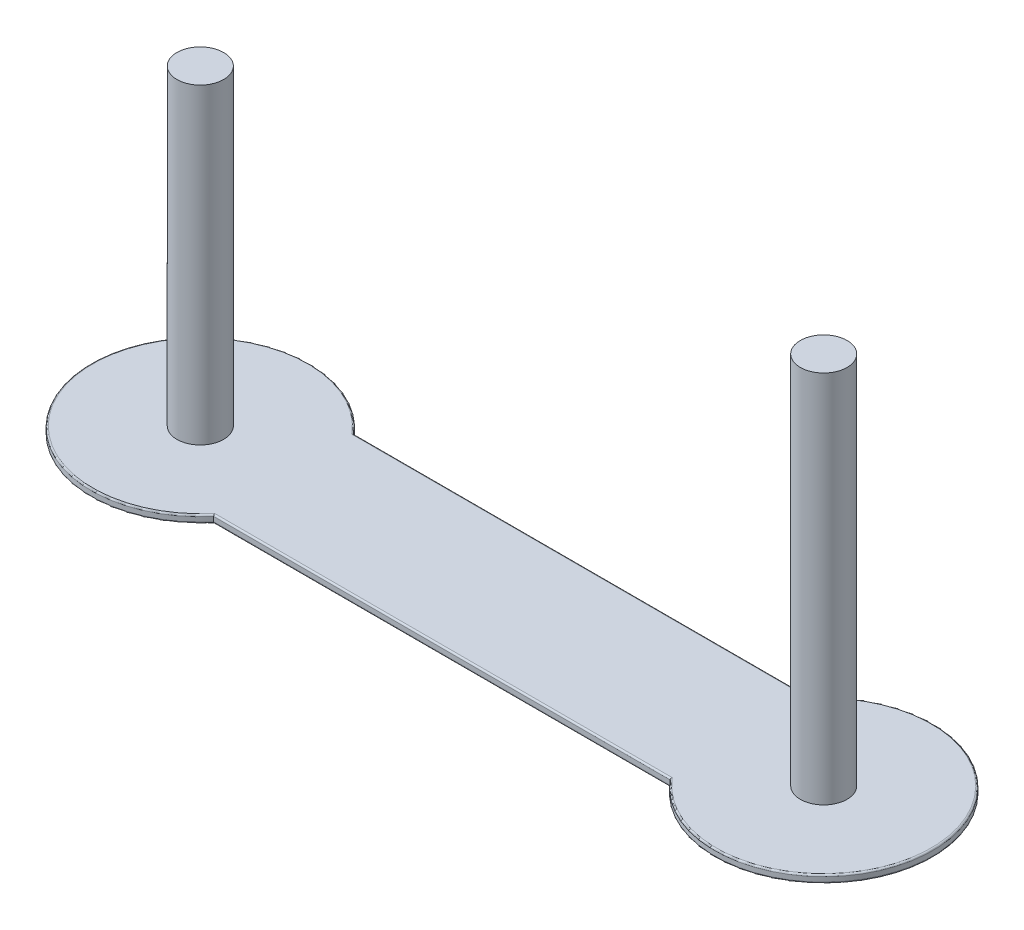
from build123d import *

# Parameters (mm, degrees)
BOSS_EXTRUDE1_DEPTH = 3.175
SKETCH2_R           = 9.525
BOSS_EXTRUDE2_DEPTH = 127
SKETCH4_R           = 9.525
BOSS_EXTRUDE3_DEPTH = 152.4
FILLET3_R           = 0.635


with BuildPart() as part:
    # Sketch1 → Boss-Extrude1 (new body)
    with BuildSketch(Plane(origin=(0, 0, 0), x_dir=(1, 0, 0), z_dir=(0, 1, 0))):
        with BuildLine():
            Line((92.951918189, 28.575), (-92.951918189, 28.575))
            ThreePointArc((-92.951918189, 28.575), (-171.45, 0), (-92.951918189, -28.575))
            Line((-92.951918189, -28.575), (92.951918189, -28.575))
            ThreePointArc((92.951918189, -28.575), (171.45, 0), (92.951918189, 28.575))
        make_face()
    extrude(amount=BOSS_EXTRUDE1_DEPTH)

    # Sketch2 → Boss-Extrude2 (add)
    with BuildSketch(Plane(origin=(0, 3.175, 0), x_dir=(1, 0, 0), z_dir=(0, 1, 0))):
        with Locations((-127, 0)):
            Circle(SKETCH2_R)
    extrude(amount=BOSS_EXTRUDE2_DEPTH)

    # Sketch4 → Boss-Extrude3 (add)
    with BuildSketch(Plane(origin=(0, 3.175, 0), x_dir=(1, 0, 0), z_dir=(0, 1, 0))):
        with Locations((127, 0)):
            Circle(SKETCH4_R)
    extrude(amount=BOSS_EXTRUDE3_DEPTH)

    # Fillet3
    fillet3_edges = [part.edges().sort_by_distance(p)[0] for p in [
        (0, 3.175, -28.575),
        (171.45, 3.175, 0),
        (0, 3.175, 28.575),
        (-171.45, 3.175, 0),
        (0, 0, -28.575),
        (171.45, 0, 0),
        (0, 0, 28.575),
        (-171.45, 0, 0),
    ]]
    fillet(fillet3_edges, radius=FILLET3_R)


solid = part.part
